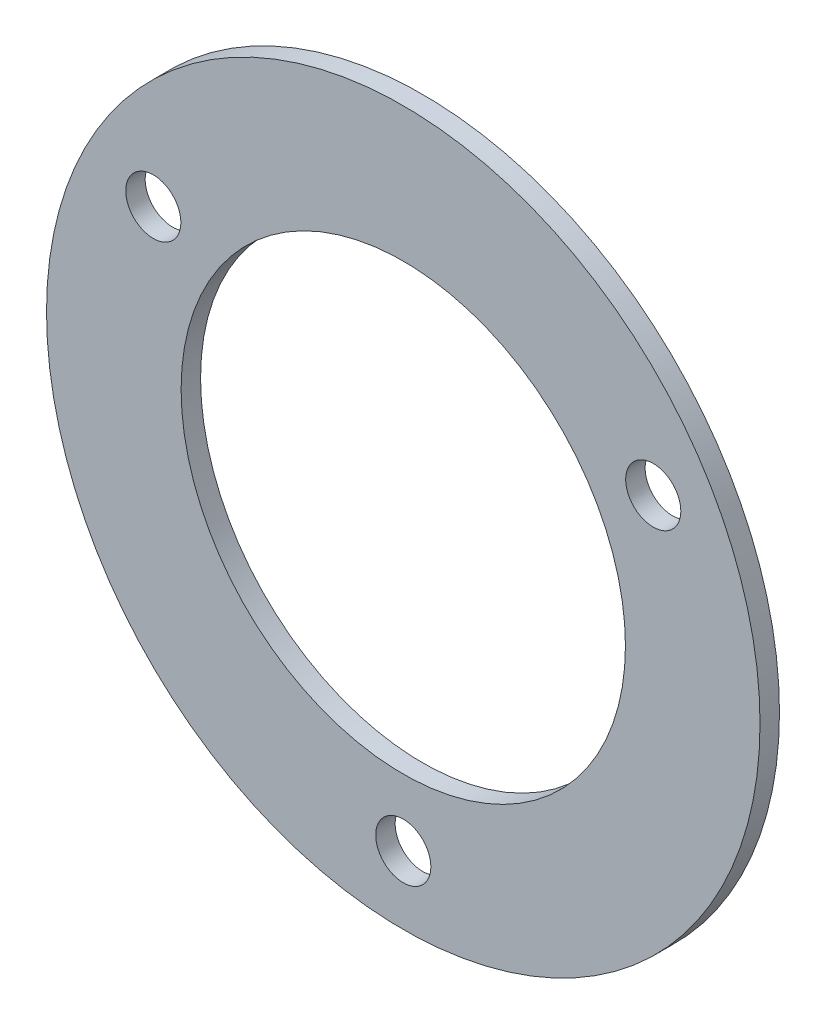
from build123d import *

# Parameters (mm, degrees)
SKETCH_1_R             = 110
SKETCH_1_R_2           = 68.5
SKETCH_1_R_3           = 8.5
SM_BASE_FLANGE_1_DEPTH = 6


# Sheet-metal steps are written as plain solids
with BuildPart() as part:
    # Sketch 1 → Базовая кромка1 (new body)
    with BuildSketch(Plane.XY):
        Circle(SKETCH_1_R)
        Circle(SKETCH_1_R_2, mode=Mode.SUBTRACT)
        with Locations((77.076260937, 44.5)):
            Circle(SKETCH_1_R_3, mode=Mode.SUBTRACT)
        with Locations((0, -89)):
            Circle(SKETCH_1_R_3, mode=Mode.SUBTRACT)
        with Locations((-77.076260937, 44.5)):
            Circle(SKETCH_1_R_3, mode=Mode.SUBTRACT)
    extrude(amount=-SM_BASE_FLANGE_1_DEPTH)


solid = part.part
